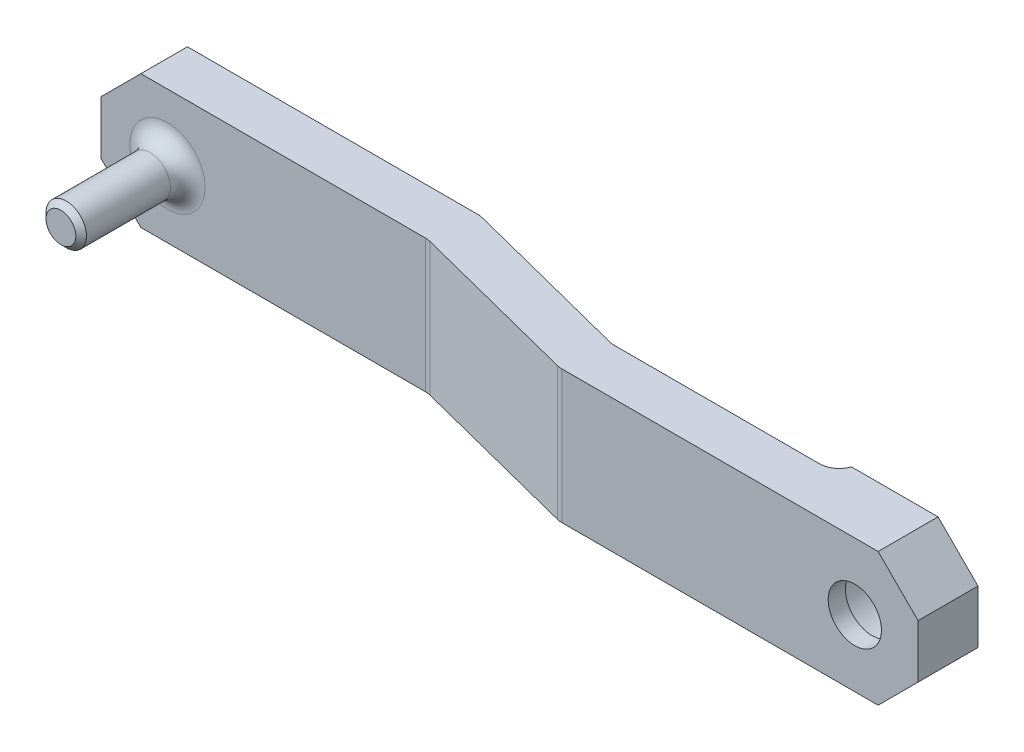
from build123d import *

# Parameters (mm, degrees)
BOSS_EXTRUDE1_DEPTH = 12.7
SKETCH2_R           = 4.1148
CUT_EXTRUDE1_DEPTH  = 4.064
SKETCH3_R           = 2.54
CUT_EXTRUDE2_DEPTH  = 84.509486698
SKETCH4_R           = 1.9304
BOSS_EXTRUDE2_DEPTH = 10.16
FILLET1_R           = 1.651
CHAMFER1_SIZE       = 3.81
FILLET2_R           = 1.905
CHAMFER2_SIZE       = 0.635
CHAMFER3_SIZE       = 0.508


with BuildPart() as part:
    # Sketch1 → Boss-Extrude1 (new body)
    with BuildSketch(Plane(origin=(0, 0, 0), x_dir=(1, 0, 0), z_dir=(0, 1, 0))):
        Polygon((0, 0), (0, -4.445), (31.190740793, -4.445), (48.018240793, -8.7475), (82.2325, -8.7475), (82.2325, -3.0325), (70.1675, -3.0325), (70.1675, -4.3025), (48.5775, -4.3025), (31.75, 0), align=None)
    extrude(amount=BOSS_EXTRUDE1_DEPTH)

    # Sketch2 → Cut-Extrude1 (cut)
    with BuildSketch(Plane(origin=(0, 0, 3.0325), x_dir=(-1, 0, 0), z_dir=(0, 0, -1))):
        with Locations((-76.2, 6.35)):
            Circle(SKETCH2_R)
    extrude(amount=-CUT_EXTRUDE1_DEPTH, mode=Mode.SUBTRACT)

    # Sketch3 → Cut-Extrude2 (cut, through all)
    with BuildSketch(Plane(origin=(0, 0, 7.0965), x_dir=(-1, 0, 0), z_dir=(0, 0, -1))):
        with Locations((-76.2, 6.35)):
            Circle(SKETCH3_R)
    extrude(amount=-CUT_EXTRUDE2_DEPTH, mode=Mode.SUBTRACT)

    # Sketch4 → Boss-Extrude2 (add)
    with BuildSketch(Plane(origin=(0, 0, 4.445), x_dir=(-1, 0, 0), z_dir=(0, 0, -1))):
        with Locations((-6.35, 6.35)):
            Circle(SKETCH4_R)
    extrude(amount=-BOSS_EXTRUDE2_DEPTH)

    # Fillet1
    fillet1_edges = [part.edges().sort_by_distance(p)[0] for p in [
        (8.2804, 6.35, 4.445),
    ]]
    fillet(fillet1_edges, radius=FILLET1_R)

    # Chamfer1
    chamfer1_edges = [part.edges().sort_by_distance(p)[0] for p in [
        (82.2325, 0, 5.89),
        (0, 0, 2.2225),
        (82.2325, 12.7, 5.89),
        (0, 12.7, 2.2225),
    ]]
    chamfer(chamfer1_edges, length=CHAMFER1_SIZE)

    # Fillet2
    # the kernel refuses this fillet: 1.905 mm, written as the material it adds along each edge
    with BuildSketch(Plane(origin=(31.190740793, 0, 4.445), x_dir=(-1, 0, 0), z_dir=(0, 1, 0))) as fillet2_piece_1:
        with BuildLine():
            CenterArc((FILLET2_R * 0.125817594312, FILLET2_R), FILLET2_R, 255.657728572, 14.342271428)
            Line((-FILLET2_R * 0.121896267277, FILLET2_R * 0.0311667621428), (0, 0))
            Line((0, 0), (FILLET2_R * 0.125817594312, 0))
        make_face()
    extrude(amount=12.7)
    with BuildSketch(Plane(origin=(48.5775, 0, 4.3025), x_dir=(-0.96883323785722, 0, -0.24771386158851796), z_dir=(0, 1, 0))) as fillet2_piece_2:
        with BuildLine():
            CenterArc((FILLET2_R * 0.125817594312, -FILLET2_R), FILLET2_R, 90, 14.342271428)
            Line((-FILLET2_R * 0.121896267277, -FILLET2_R * 0.0311667621428), (0, 0))
            Line((0, 0), (FILLET2_R * 0.125817594312, 0))
        make_face()
    extrude(amount=12.7)
    with BuildSketch(Plane(origin=(70.1675, 0, 4.3025), x_dir=(-1, 0, 0), z_dir=(0, 1, 0))) as fillet2_piece_3:
        with BuildLine():
            CenterArc((1.796051224, -1.905), FILLET2_R, 90, 70.528779366)
            Line((0, -1.27), (0, 0))
            Line((0, 0), (1.796051224, 0))
        make_face()
    extrude(amount=12.7)
    # the kernel refuses this fillet: 1.905 mm, written as the material it takes off along each edge
    with BuildSketch(Plane(origin=(48.018240793, -0.599206293, 8.7475), x_dir=(-0.96883323785722, 0, -0.24771386158851796), z_dir=(0, 1, 0))) as fillet2_2_piece_1:
        with BuildLine():
            CenterArc((FILLET2_R * 0.125817594312, -FILLET2_R), FILLET2_R, 90, 14.342271428)
            Line((-FILLET2_R * 0.121896267277, -FILLET2_R * 0.0311667621428), (0, 0))
            Line((0, 0), (FILLET2_R * 0.125817594312, 0))
        make_face()
    extrude(amount=13.898412586, mode=Mode.SUBTRACT)
    with BuildSketch(Plane(origin=(31.75, -0.599206293, 0), x_dir=(-1, 0, 0), z_dir=(0, 1, 0))) as fillet2_2_piece_2:
        with BuildLine():
            CenterArc((FILLET2_R * 0.125817594312, FILLET2_R), FILLET2_R, 255.657728572, 14.342271428)
            Line((-FILLET2_R * 0.121896267277, FILLET2_R * 0.0311667621428), (0, 0))
            Line((0, 0), (FILLET2_R * 0.125817594312, 0))
        make_face()
    extrude(amount=13.898412586, mode=Mode.SUBTRACT)

    # Chamfer2
    chamfer2_edges = [part.edges().sort_by_distance(p)[0] for p in [
        (80.3148, 6.35, 3.0325),
    ]]
    chamfer(chamfer2_edges, length=CHAMFER2_SIZE)

    # Chamfer3
    chamfer3_edges = [part.edges().sort_by_distance(p)[0] for p in [
        (8.2804, 6.35, 14.605),
    ]]
    chamfer(chamfer3_edges, length=CHAMFER3_SIZE)


solid = part.part
